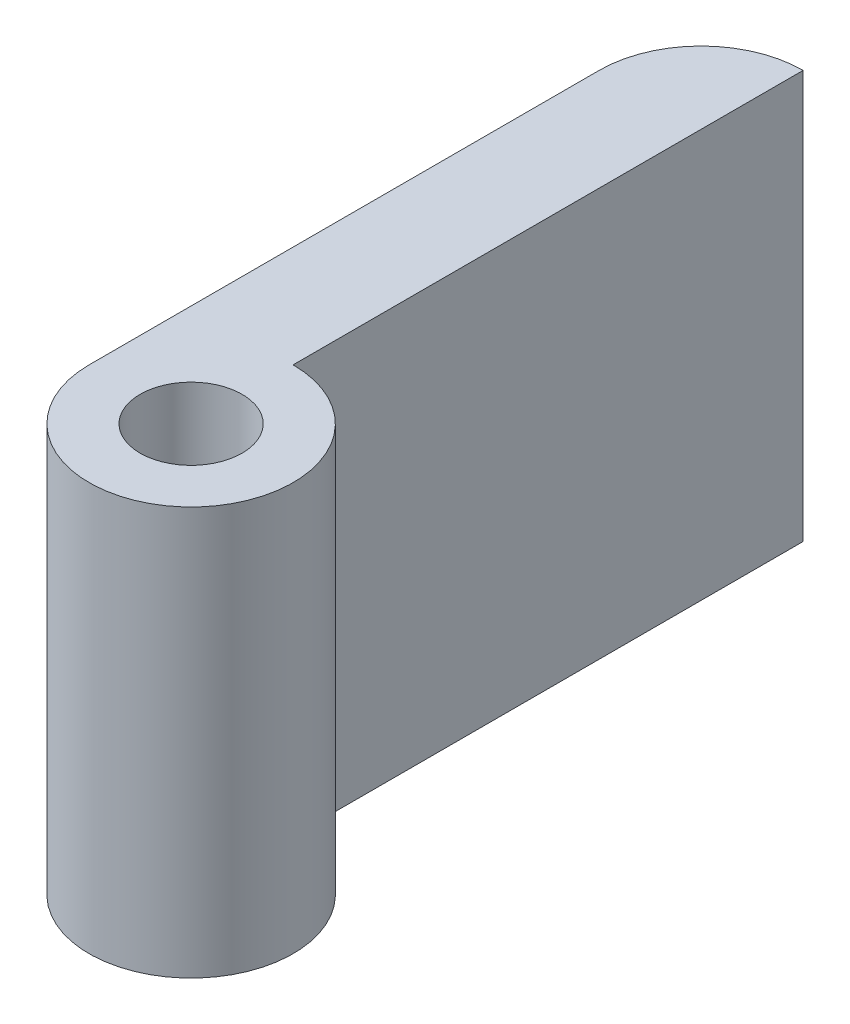
from build123d import *

# Parameters (mm, degrees)
SKETCH1_R           = 2.5
BOSS_EXTRUDE1_DEPTH = 20
FILLET1_R           = 5


with BuildPart() as part:
    # Sketch1 → Boss-Extrude1 (new body)
    with BuildSketch(Plane(origin=(0, 0, 0), x_dir=(1, 0, 0), z_dir=(0, 1, 0))):
        with BuildLine():
            Line((0, 30), (0, 5))
            ThreePointArc((0, 5), (3.535533906, -3.535533906), (-5, 0))
            Line((-5, 0), (-5, 5))
            Line((-5, 5), (-5, 30))
            Line((-5, 30), (0, 30))
        make_face()
        with Locations(Location((0, 0, 0), (0, 0, 270))):
            Circle(SKETCH1_R, mode=Mode.SUBTRACT)
    extrude(amount=BOSS_EXTRUDE1_DEPTH)

    # Fillet1
    fillet1_edges = [part.edges().sort_by_distance(p)[0] for p in [
        (-5, 10, -30),
    ]]
    fillet(fillet1_edges, radius=FILLET1_R - 0.0001)  # a hair under: the kernel refuses the full size


solid = part.part
